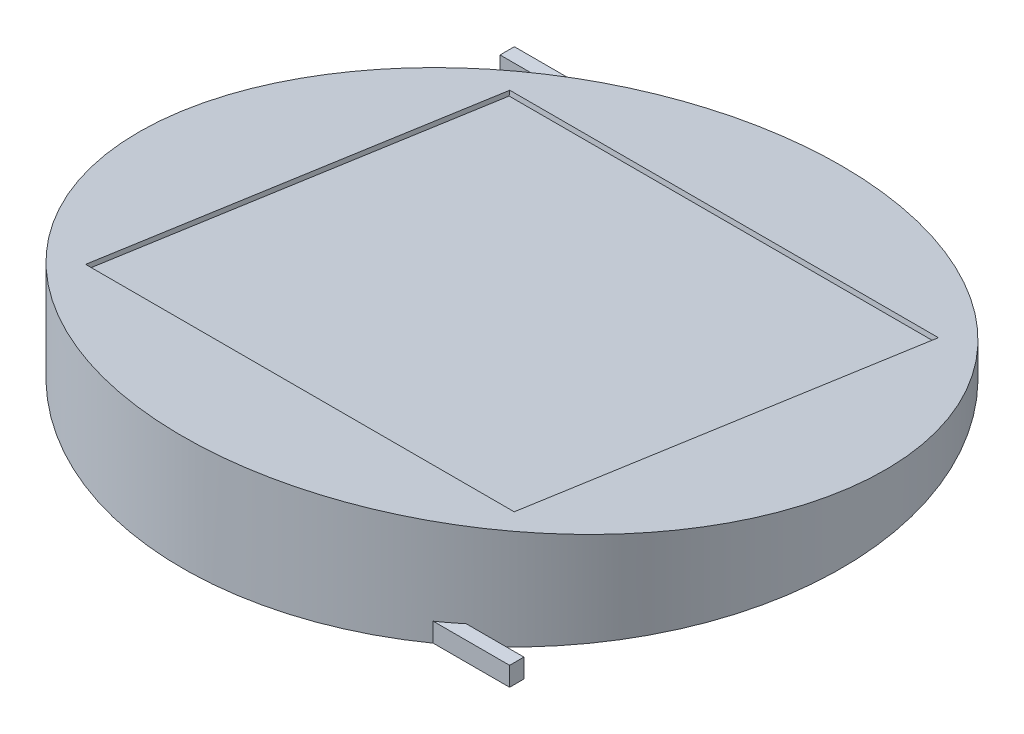
from build123d import *

# Parameters (mm, degrees)
BOSS_EXTRUDE1_DEPTH     = 2
CUT_EXTRUDE4_DEPTH      = 22
CUT_EXTRUDE4_DEPTH_BACK = 21
SKETCH1_6_W             = 28
SKETCH1_6_H             = 1.5
EXTRUDE_THIN1_DEPTH     = 2
SKETCH17_R              = 34.6
BOSS_EXTRUDE6_DEPTH     = 10
SKETCH20_W              = 45
SKETCH20_H              = 45
CUT_EXTRUDE7_DEPTH      = 0.5


with BuildPart() as part:
    # Sketch1 → Boss-Extrude1 (new body)
    with BuildSketch(Plane(origin=(0, 0, 0), x_dir=(1, 0, 0), z_dir=(0, 1, 0))):
        with BuildLine():
            ThreePointArc((-20.997857034, 27.5), (-27.5, -20.997857034), (20.997857034, -27.5))
            ThreePointArc((20.997857034, -27.5), (27.5, 20.997857034), (-20.997857034, 27.5))
        make_face()
    extrude(amount=BOSS_EXTRUDE1_DEPTH)

    # Sketch7 → Cut-Extrude4 (cut, two sides: drawn at the far end of the back side and taken through both)
    with BuildSketch(Plane.XY.offset(-CUT_EXTRUDE4_DEPTH_BACK)):
        Polygon((-34.6, 1), (-29.75, 0), (-34.6, 0), align=None)
    extrude(amount=CUT_EXTRUDE4_DEPTH + CUT_EXTRUDE4_DEPTH_BACK, mode=Mode.SUBTRACT)

    # Sketch1<6> → Extrude-Thin1 (add)
    with BuildSketch(Plane(origin=(0, 0, 0), x_dir=(1, 0, 0), z_dir=(0, 1, 0))):
        with Locations((-14, 27.5)):
            Rectangle(SKETCH1_6_W, SKETCH1_6_H)
        with Locations((14, -27.5)):
            Rectangle(SKETCH1_6_W, SKETCH1_6_H)
    extrude(amount=EXTRUDE_THIN1_DEPTH)

    # Sketch17 → Boss-Extrude6 (add)
    with BuildSketch(Plane(origin=(0, 2, 0), x_dir=(1, 0, 0), z_dir=(0, 1, 0))):
        Circle(SKETCH17_R)
    extrude(amount=BOSS_EXTRUDE6_DEPTH)

    # Split1
    split(bisect_by=Plane(origin=(0, 6.856810892, -0.990868626), x_dir=(0, -0.14302302901936856, -0.9897193608140263), z_dir=(0, -0.9897193608140263, 0.14302302901936856)), keep=Keep.TOP)

    # Sketch20 → Cut-Extrude7 (cut)
    with BuildSketch(Plane(origin=(0, 6.856810892, -0.990868626), x_dir=(-1, 0, 0), z_dir=(0, -0.9897193608140263, 0.14302302901936856))):
        with Locations((0, -1.001161203)):
            Rectangle(SKETCH20_W, SKETCH20_H)
    extrude(amount=CUT_EXTRUDE7_DEPTH, mode=Mode.SUBTRACT)


solid = part.part
